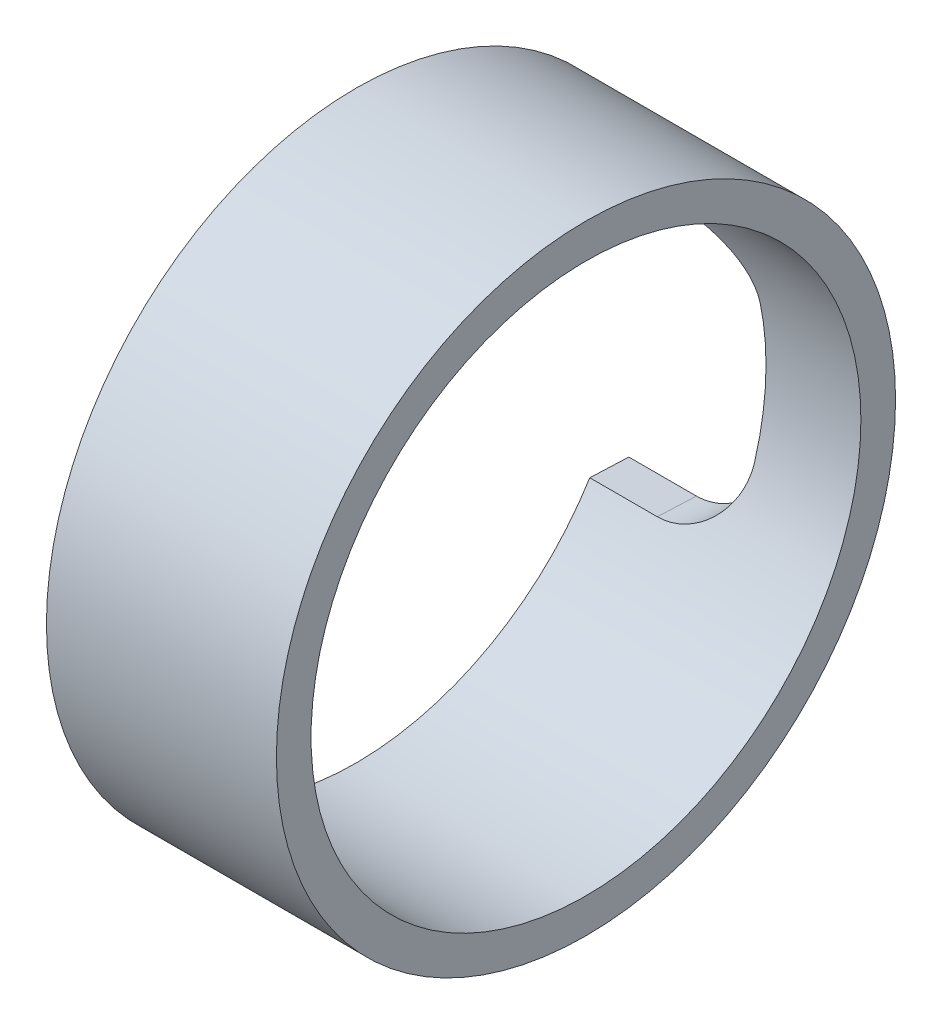
from build123d import *

# Parameters (mm, degrees)
SKETCH1_W          = 6.485999982
SKETCH1_H          = 0.977250014
CUT_EXTRUDE1_REACH = 42.92


with BuildPart() as part:
    # Sketch1 → Revolve1 (revolve)
    with BuildSketch(Plane.XY):
        with Locations((-35.769999961, 8.242624993)):
            Rectangle(SKETCH1_W, SKETCH1_H)
    revolve(axis=Axis((0, 0, 0), (-1, 0, 0)))

    # Sketch3 → Cut-Extrude1 (cut, up to next)
    with BuildSketch(Plane(origin=(0, 0, 0), x_dir=(1, 0, 0), z_dir=(0, -0.040690746456462146, -0.9991717886093543)), mode=Mode.PRIVATE) as cut_extrude1_sk1:
        with BuildLine():
            Line((-39.012999952, 3.81), (-39.012999952, -3.81))
            Line((-39.012999952, -3.81), (-37.107999952, -3.81))
            ThreePointArc((-37.107999952, -3.81), (-35.760961534, -3.252038418), (-35.202999952, -1.905))
            Line((-35.202999952, -1.905), (-35.202999952, 1.905))
            ThreePointArc((-35.202999952, 1.905), (-35.760961534, 3.252038418), (-37.107999952, 3.81))
            Line((-37.107999952, 3.81), (-39.012999952, 3.81))
        make_face()
    cut_extrude1_tool1 = extrude(cut_extrude1_sk1.sketch, amount=CUT_EXTRUDE1_REACH, mode=Mode.PRIVATE) & part.part
    add(cut_extrude1_tool1.solids().sort_by_distance((-37.191875, 0, 0))[0], mode=Mode.SUBTRACT)


solid = part.part
